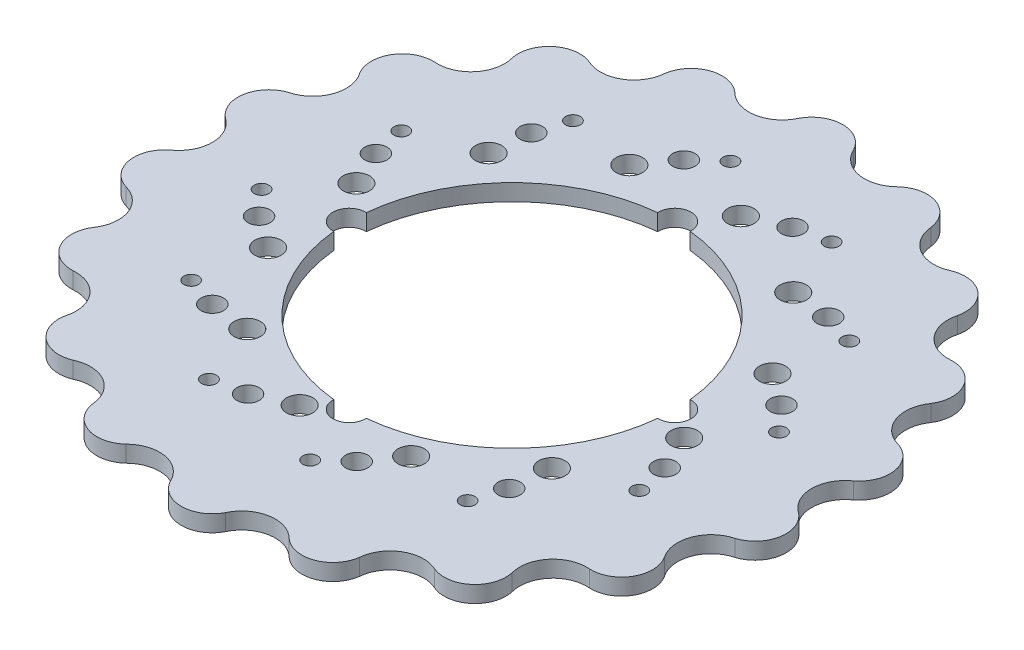
from build123d import *

# Parameters (mm, degrees)
BOSS_EXTRUDE1_DEPTH = 5.08
CUT_EXTRUDE1_DEPTH  = 143.788607915
SKETCH4_R           = 4.035126609
SKETCH4_R_2         = 3.424460764
SKETCH4_R_3         = 2.259606703
CUT_EXTRUDE3_DEPTH  = 143.788607915


with BuildPart() as part:
    # Sketch2 → Boss-Extrude1 (new body)
    with BuildSketch(Plane(origin=(0, 0, 0), x_dir=(1, 0, 0), z_dir=(0, 1, 0))):
        with BuildLine():
            ThreePointArc((96.469004076, 8.439944238), (100.056467706, 17.642654851), (93.537842203, 25.06338928))
            ThreePointArc((93.537842203, 25.06338928), (86.522198059, 31.491504697), (87.764580327, 40.925295921))
            ThreePointArc((87.764580327, 40.925295921), (87.988181024, 50.8), (79.324636089, 55.543708155))
            ThreePointArc((79.324636089, 55.543708155), (70.5335421, 59.184669162), (68.474452923, 68.474452923))
            ThreePointArc((68.474452923, 68.474452923), (65.307221144, 77.830115421), (55.543708155, 79.324636089))
            ThreePointArc((55.543708155, 79.324636089), (46.0375, 79.739289053), (40.925295921, 87.764580327))
            ThreePointArc((40.925295921, 87.764580327), (34.749246562, 95.472770272), (25.06338928, 93.537842203))
            ThreePointArc((25.06338928, 93.537842203), (15.988655959, 90.676173859), (8.439944238, 96.469004076))
            ThreePointArc((8.439944238, 96.469004076), (0, 101.6), (-8.439944238, 96.469004076))
            ThreePointArc((-8.439944238, 96.469004076), (-15.988655959, 90.676173859), (-25.06338928, 93.537842203))
            ThreePointArc((-25.06338928, 93.537842203), (-34.749246562, 95.472770272), (-40.925295921, 87.764580327))
            ThreePointArc((-40.925295921, 87.764580327), (-46.0375, 79.739289053), (-55.543708155, 79.324636089))
            ThreePointArc((-55.543708155, 79.324636089), (-65.307221144, 77.830115421), (-68.474452923, 68.474452923))
            ThreePointArc((-68.474452923, 68.474452923), (-70.5335421, 59.184669162), (-79.324636089, 55.543708155))
            ThreePointArc((-79.324636089, 55.543708155), (-87.988181024, 50.8), (-87.764580327, 40.925295921))
            ThreePointArc((-87.764580327, 40.925295921), (-86.522198059, 31.491504697), (-93.537842203, 25.06338928))
            ThreePointArc((-93.537842203, 25.06338928), (-100.056467706, 17.642654851), (-96.469004076, 8.439944238))
            ThreePointArc((-96.469004076, 8.439944238), (-92.075, 0), (-96.469004076, -8.439944238))
            ThreePointArc((-96.469004076, -8.439944238), (-100.056467706, -17.642654851), (-93.537842203, -25.06338928))
            ThreePointArc((-93.537842203, -25.06338928), (-86.522198059, -31.491504697), (-87.764580327, -40.925295921))
            ThreePointArc((-87.764580327, -40.925295921), (-87.988181024, -50.8), (-79.324636089, -55.543708155))
            ThreePointArc((-79.324636089, -55.543708155), (-70.5335421, -59.184669162), (-68.474452923, -68.474452923))
            ThreePointArc((-68.474452923, -68.474452923), (-65.307221144, -77.830115421), (-55.543708155, -79.324636089))
            ThreePointArc((-55.543708155, -79.324636089), (-46.0375, -79.739289053), (-40.925295921, -87.764580327))
            ThreePointArc((-40.925295921, -87.764580327), (-34.749246562, -95.472770272), (-25.06338928, -93.537842203))
            ThreePointArc((-25.06338928, -93.537842203), (-15.988655959, -90.676173859), (-8.439944238, -96.469004076))
            ThreePointArc((-8.439944238, -96.469004076), (0, -101.6), (8.439944238, -96.469004076))
            ThreePointArc((8.439944238, -96.469004076), (15.988655959, -90.676173859), (25.06338928, -93.537842203))
            ThreePointArc((25.06338928, -93.537842203), (34.749246562, -95.472770272), (40.925295921, -87.764580327))
            ThreePointArc((40.925295921, -87.764580327), (46.0375, -79.739289053), (55.543708155, -79.324636089))
            ThreePointArc((55.543708155, -79.324636089), (65.307221144, -77.830115421), (68.474452923, -68.474452923))
            ThreePointArc((68.474452923, -68.474452923), (70.5335421, -59.184669162), (79.324636089, -55.543708155))
            ThreePointArc((79.324636089, -55.543708155), (87.988181024, -50.8), (87.764580327, -40.925295921))
            ThreePointArc((87.764580327, -40.925295921), (86.522198059, -31.491504697), (93.537842203, -25.06338928))
            ThreePointArc((93.537842203, -25.06338928), (100.056467706, -17.642654851), (96.469004076, -8.439944238))
            ThreePointArc((96.469004076, -8.439944238), (92.075, 0), (96.469004076, 8.439944238))
        make_face()
    extrude(amount=BOSS_EXTRUDE1_DEPTH)

    # Sketch3 → Cut-Extrude1 (cut, through all)
    with BuildSketch(Plane(origin=(0, 5.08, 0), x_dir=(1, 0, 0), z_dir=(0, 1, 0))):
        with BuildLine():
            ThreePointArc((49.75, -4.993746089), (55, 0), (49.75, 4.993746089))
            ThreePointArc((49.75, 4.993746089), (35.355339059, 35.355339059), (4.993746089, 49.75))
            ThreePointArc((4.993746089, 49.75), (0, 55), (-4.993746089, 49.75))
            ThreePointArc((-4.993746089, 49.75), (-35.355339059, 35.355339059), (-49.75, 4.993746089))
            ThreePointArc((-49.75, 4.993746089), (-55, 0), (-49.75, -4.993746089))
            ThreePointArc((-49.75, -4.993746089), (-35.355339059, -35.355339059), (-4.993746089, -49.75))
            ThreePointArc((-4.993746089, -49.75), (0, -55), (4.993746089, -49.75))
            ThreePointArc((4.993746089, -49.75), (35.355339059, -35.355339059), (49.75, -4.993746089))
        make_face()
    extrude(amount=-CUT_EXTRUDE1_DEPTH, mode=Mode.SUBTRACT)

    # Sketch4 → Cut-Extrude3 (cut, through all)
    with BuildSketch(Plane(origin=(0, 5.08, 0), x_dir=(1, 0, 0), z_dir=(0, 1, 0))):
        with Locations((8.709228258, 61.609264585)):
            Circle(SKETCH4_R)
        with Locations((19.636546728, 66.55036178)):
            Circle(SKETCH4_R_2)
        with Locations((29.553775935, 68.643430263)):
            Circle(SKETCH4_R_3)
        with Locations((37.077045211, 49.340869584)):
            Circle(SKETCH4_R)
        with Locations((49.010929199, 48.156326042)):
            Circle(SKETCH4_R_2)
        with Locations((58.646035869, 45.010361917)):
            Circle(SKETCH4_R_3)
        with Locations((55.510097842, 24.532219374)):
            Circle(SKETCH4_R)
        with Locations((65.252872771, 17.539432581)):
            Circle(SKETCH4_R_2)
        with Locations((72.024137852, 9.997394394)):
            Circle(SKETCH4_R_3)
        with Locations((59.069264585, -6.169228258)):
            Circle(SKETCH4_R)
        with Locations((64.01036178, -17.096546728)):
            Circle(SKETCH4_R_2)
        with Locations((66.103430263, -27.013775935)):
            Circle(SKETCH4_R_3)
        with Locations((46.800869584, -34.537045211)):
            Circle(SKETCH4_R)
        with Locations((45.616326042, -46.470929199)):
            Circle(SKETCH4_R_2)
        with Locations((42.470361917, -56.106035869)):
            Circle(SKETCH4_R_3)
        with Locations((21.992219374, -52.970097842)):
            Circle(SKETCH4_R)
        with Locations((14.999432581, -62.712872771)):
            Circle(SKETCH4_R_2)
        with Locations((7.457394394, -69.484137852)):
            Circle(SKETCH4_R_3)
        with Locations((-8.709228258, -56.529264585)):
            Circle(SKETCH4_R)
        with Locations((-19.636546728, -61.47036178)):
            Circle(SKETCH4_R_2)
        with Locations((-29.553775935, -63.563430263)):
            Circle(SKETCH4_R_3)
        with Locations((-37.077045211, -44.260869584)):
            Circle(SKETCH4_R)
        with Locations((-49.010929199, -43.076326042)):
            Circle(SKETCH4_R_2)
        with Locations((-58.646035869, -39.930361917)):
            Circle(SKETCH4_R_3)
        with Locations((-55.510097842, -19.452219374)):
            Circle(SKETCH4_R)
        with Locations((-65.252872771, -12.459432581)):
            Circle(SKETCH4_R_2)
        with Locations((-72.024137852, -4.917394394)):
            Circle(SKETCH4_R_3)
        with Locations((-59.069264585, 11.249228258)):
            Circle(SKETCH4_R)
        with Locations((-64.01036178, 22.176546728)):
            Circle(SKETCH4_R_2)
        with Locations((-66.103430263, 32.093775935)):
            Circle(SKETCH4_R_3)
        with Locations((-46.800869584, 39.617045211)):
            Circle(SKETCH4_R)
        with Locations((-45.616326042, 51.550929199)):
            Circle(SKETCH4_R_2)
        with Locations((-42.470361917, 61.186035869)):
            Circle(SKETCH4_R_3)
        with Locations((-21.992219374, 58.050097842)):
            Circle(SKETCH4_R)
        with Locations((-14.999432581, 67.792872771)):
            Circle(SKETCH4_R_2)
        with Locations((-7.457394394, 74.564137852)):
            Circle(SKETCH4_R_3)
    extrude(amount=-CUT_EXTRUDE3_DEPTH, mode=Mode.SUBTRACT)


solid = part.part
